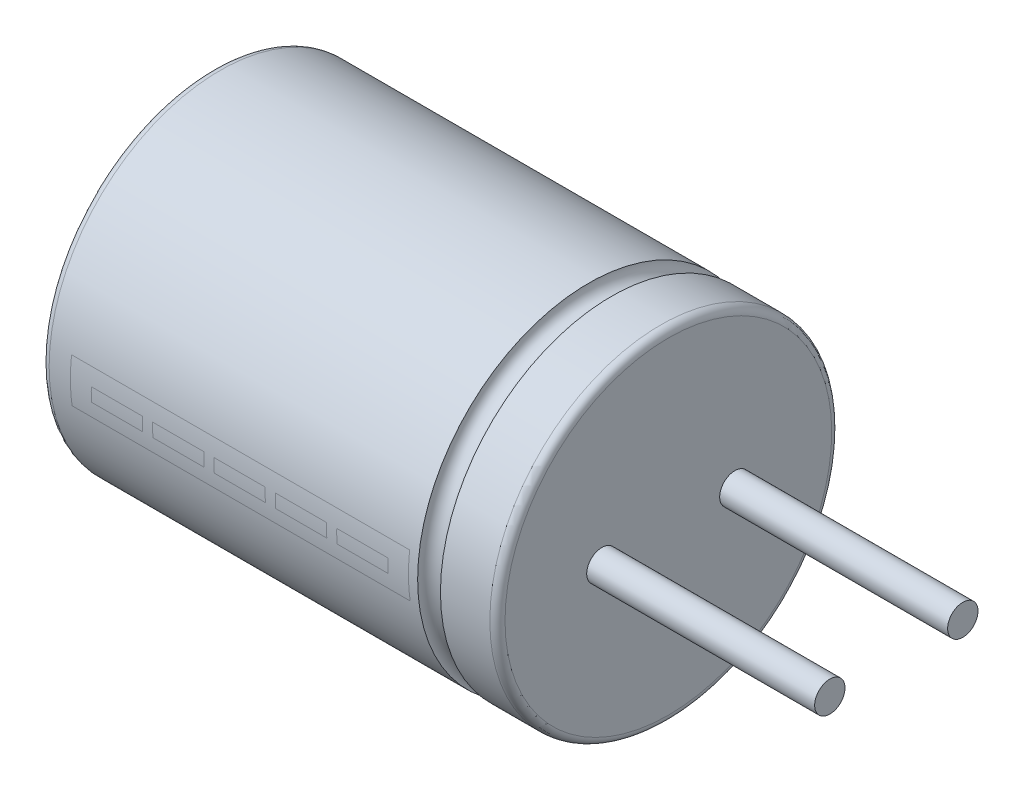
from build123d import *

# Parameters (mm, degrees)
SKETCH6_R           = 0.4
BOSS_EXTRUDE1_DEPTH = 6
CUT_EXTRUDE1_DEPTH  = 0.2
FILLET2_R           = 0.2


with BuildPart() as part:
    # Sketch1 → Revolve1 (revolve)
    with BuildSketch(Plane(origin=(0, 0, 0), x_dir=(1, 0, 0), z_dir=(0, 1, 0))):
        with BuildLine():
            Line((-5.95, -1.25), (-6.05, -1.25))
            Line((-6.05, -1.25), (-6.05, -2.25))
            Line((-6.05, -2.25), (-5.95, -2.25))
            Line((-5.95, -2.25), (3.85, -2.25))
            ThreePointArc((3.85, -2.25), (4.15, -1.95), (4.45, -2.25))
            Line((4.45, -2.25), (5.95, -2.25))
            Line((5.95, -2.25), (5.95, 2.25))
            Line((5.95, 2.25), (-5.95, 2.25))
            Line((-5.95, 2.25), (-5.95, -1.25))
        make_face()
    revolve(axis=Axis((-5.95, 0, -2.25), (1, 0, 0)))

    # Sketch6 → Boss-Extrude1 (add)
    with BuildSketch(Plane(origin=(5.95, 0, 0), x_dir=(0, 0, -1), z_dir=(1, 0, 0))):
        with Locations((0.5, 0)):
            Circle(SKETCH6_R)
        with Locations((4, 0)):
            Circle(SKETCH6_R)
    extrude(amount=BOSS_EXTRUDE1_DEPTH)

    # Sketch8 → Cut-Extrude1 (cut)
    with BuildSketch(Plane.ZY.offset(5.95)):
        Polygon((-2, -0.25), (-2, -3.325), (-2.5, -3.325), (-2.5, -0.25), (-5.575, -0.25), (-5.575, 0.25), (-2.5, 0.25), (-2.5, 3.325), (-2, 3.325), (-2, 0.25), (1.075, 0.25), (1.075, -0.25), align=None)
    extrude(amount=-CUT_EXTRUDE1_DEPTH, mode=Mode.SUBTRACT)

    # Fillet2
    fillet2_edges = [part.edges().sort_by_distance(p)[0] for p in [
        (-5.75, -3.325, -2.25),
        (-5.75, -1.7875, -2.5),
        (-5.75, -0.25, -4.0375),
        (-5.75, 0, -5.575),
        (-5.75, 0.25, -4.0375),
        (-5.75, 1.7875, -2.5),
        (-5.75, 3.325, -2.25),
        (-5.75, 1.7875, -2),
        (-5.75, 0.25, -0.4625),
        (-5.75, 0, 1.075),
        (-5.75, -0.25, -0.4625),
        (-5.75, -1.7875, -2),
        (5.95, 0, -6.75),
        (-6.05, 0, -6.75),
    ]]
    fillet(fillet2_edges, radius=FILLET2_R - 0.0001)  # a hair under: the kernel refuses the full size


solid = part.part
